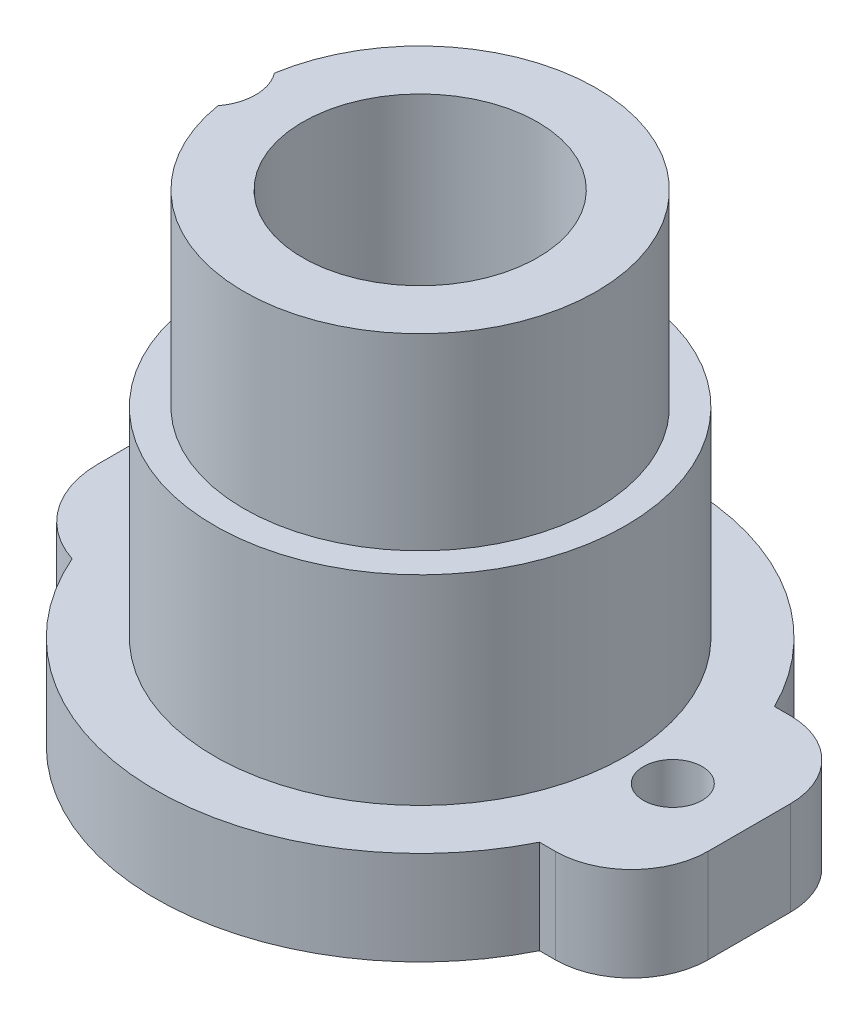
from build123d import *

# Parameters (mm, degrees)
SKETCH_9_W          = 53
SKETCH_9_H          = 36
EXTRUDE_1_DEPTH     = 16
SKETCH_10_W         = 56
SKETCH_10_H         = 40
EXTRUDE_2_DEPTH     = 16
SKETCH_11_R         = 8
CUT_EXTRUDE_3_DEPTH = 82
SKETCH_12_R         = 5
CUT_EXTRUDE_6_DEPTH = 82
FILLET_1_R          = 17
FILLET_2_R          = 13


with BuildPart() as part:
    # 草图8 → 旋转1 (revolve)
    with BuildSketch(Plane.XY, mode=Mode.PRIVATE) as revolve_1_sk:
        Polygon((20, 0), (45, 0), (45, 16), (35, 16), (35, 50), (30, 50), (30, 82), (20, 82), align=None)
    revolve(revolve_1_sk.sketch.rotate(Axis((0, -10, 0), (0, 1, 0)), 90), axis=Axis((0, -10, 0), (0, 1, 0)))

    # 草图9 → 凸台-拉伸1 (add)
    with BuildSketch(Plane(origin=(0, 0, 0), x_dir=(1, 0, 0), z_dir=(0, 1, 0))):
        with Locations((-26.5, 0)):
            Rectangle(SKETCH_9_W, SKETCH_9_H)
    extrude(amount=EXTRUDE_1_DEPTH)

    # 草图10 → 凸台-拉伸2 (add)
    with BuildSketch(Plane(origin=(0, 0, 0), x_dir=(1, 0, 0), z_dir=(0, 1, 0))):
        with Locations((28, 0)):
            Rectangle(SKETCH_10_W, SKETCH_10_H)
    extrude(amount=EXTRUDE_2_DEPTH)

    # 草图11 → 切除-拉伸3 (cut)
    with BuildSketch(Plane(origin=(0, 0, 0), x_dir=(1, 0, 0), z_dir=(0, 1, 0))):
        with Locations(Location((-36, 0, 0), (0, 0, 76.445215963))):
            Circle(SKETCH_11_R)
    extrude(amount=CUT_EXTRUDE_3_DEPTH, mode=Mode.SUBTRACT)

    # 草图12 → 切除-拉伸6 (cut)
    with BuildSketch(Plane(origin=(0, 0, 0), x_dir=(1, 0, 0), z_dir=(0, 1, 0))):
        with Locations(Location((43, 0, 0), (0, 0, 270))):
            Circle(SKETCH_12_R)
    extrude(amount=CUT_EXTRUDE_6_DEPTH, mode=Mode.SUBTRACT)

    # 圆角1
    # the kernel refuses this fillet: 17 mm, written as the material it takes off along each edge
    with BuildSketch(Plane(origin=(-53, -40.428103648, 18), x_dir=(0, 0, -1), z_dir=(0, 1, 0))) as fillet_1_piece_1:
        with BuildLine():
            CenterArc((16.171241459, -17), FILLET_1_R, 90, 72.035815704)
            Line((0, -11.756818745), (-0.323424829, -11.65195512))
            ThreePointArc((-0.323424829, -11.65195512), (-0.34, -5.878409373), (-0.34, 0))
            Line((-0.34, 0), (0, 0.34))
            Line((0, 0.34), (16.171241459, 0.34))
            Line((16.171241459, 0.34), (16.171241459, 0))
        make_face()
    extrude(amount=96.856207296, mode=Mode.SUBTRACT)

    # 圆角2
    fillet_2_edges = [part.edges().sort_by_distance(p)[0] for p in [
        (56, 8, 20),
        (56, 8, -20),
    ]]
    fillet(fillet_2_edges, radius=FILLET_2_R)


solid = part.part
